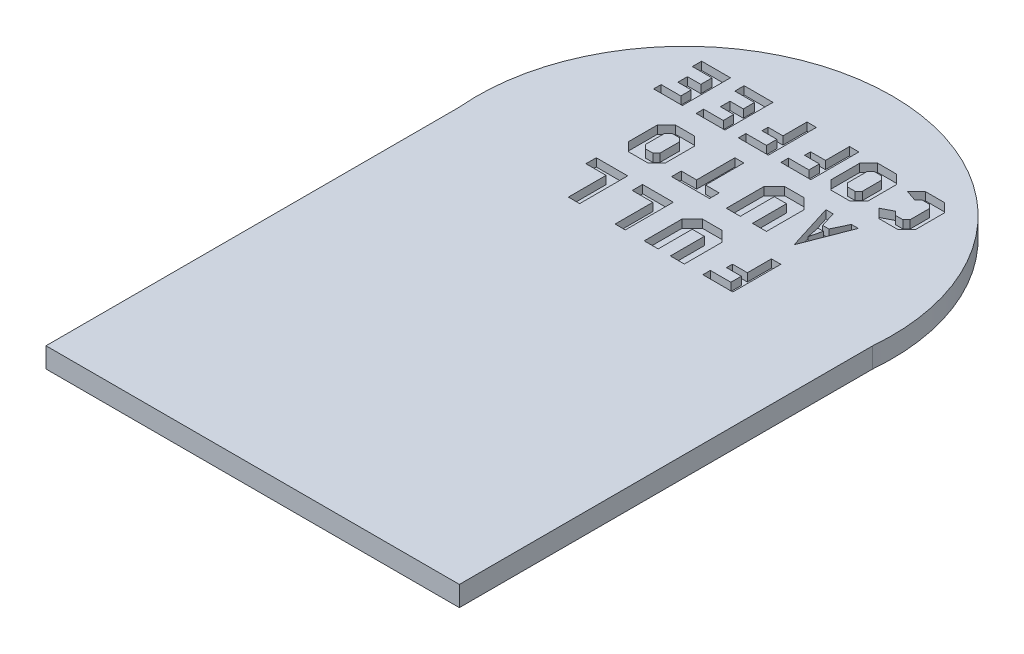
from build123d import *

# Parameters (mm, degrees)
BOSS_EXTRUDE1_DEPTH = 9.525
CUT_EXTRUDE2_DEPTH  = 3.81


with BuildPart() as part:
    # Sketch1 → Boss-Extrude1 (new body)
    with BuildSketch(Plane(origin=(0, 0, 0), x_dir=(1, 0, 0), z_dir=(0, 1, 0))):
        with BuildLine():
            Line((97.71749718, -151.170512799), (97.71749718, 44.264481562))
            ThreePointArc((97.71749718, 44.264481562), (0, 151.170512799), (-97.71749718, 44.264481562))
            Line((-97.71749718, 44.264481562), (-97.71749718, -151.170512799))
            Line((-97.71749718, -151.170512799), (97.71749718, -151.170512799))
        make_face()
    extrude(amount=BOSS_EXTRUDE1_DEPTH)

    # Sketch6 → Cut-Extrude2 (cut)
    # profile 1 of 14: a face of its own
    with BuildSketch(Plane(origin=(0, 9.525, 0), x_dir=(1, 0, 0), z_dir=(0, 1, 0))):
        Polygon((33.092657348, 98.123996841), (37.338207897, 102.36954739), (37.338207897, 115.93619224), (33.092657348, 120.181742789), (24.134649579, 120.181742789), (19.88909903, 115.93619224), (19.88909903, 102.36954739), (24.134649579, 98.123996841), align=None)
        Polygon((32.009058395, 105.057212183), (32.009058395, 114.223251329), (30.296117484, 115.93619224), (26.763976293, 115.93619224), (25.051035382, 114.223251329), (25.051035382, 105.057212183), (26.763976293, 103.344271272), (30.296117484, 103.344271272), align=None, mode=Mode.SUBTRACT)
    # profile 2 of 14: a face of its own
    with BuildSketch(Plane(origin=(0, 9.525, 0), x_dir=(1, 0, 0), z_dir=(0, 1, 0))):
        Polygon((15.096379444, 120.341514173), (15.096379444, 97.632030055), (0.938697555, 97.632030055), (0.938697555, 101.16971786), (10.645362719, 101.16971786), (10.645362719, 106.118213826), (3.603272306, 106.118213826), (3.603272306, 108.986772114), (10.645362719, 108.986772114), (10.645362719, 120.341514173), align=None)
    # profile 3 of 14: a face of its own
    with BuildSketch(Plane(origin=(0, 9.525, 0), x_dir=(1, 0, 0), z_dir=(0, 1, 0))):
        Polygon((-5.001442416, 120.341514173), (-5.001442416, 97.632030055), (-19.159124305, 97.632030055), (-19.159124305, 101.16971786), (-9.452459141, 101.16971786), (-9.452459141, 106.118213826), (-16.494549554, 106.118213826), (-16.494549554, 108.986772114), (-9.452459141, 108.986772114), (-9.452459141, 120.341514173), align=None)
    # profile 4 of 14: a face of its own
    with BuildSketch(Plane(origin=(0, 9.525, 0), x_dir=(1, 0, 0), z_dir=(0, 1, 0))):
        Polygon((-25.530137945, 97.632030055), (-25.530137945, 120.341514173), (-39.154208677, 120.341514173), (-39.154208677, 115.93619224), (-29.852737402, 115.93619224), (-29.852737402, 110.647749127), (-36.164450053, 110.647749127), (-36.164450053, 106.118213826), (-29.852737402, 106.118213826), (-29.852737402, 101.16971786), (-39.154208677, 101.16971786), (-39.154208677, 97.632030055), align=None)
    # profile 5 of 14: a face of its own
    with BuildSketch(Plane(origin=(0, 9.525, 0), x_dir=(1, 0, 0), z_dir=(0, 1, 0))):
        Polygon((-45.629989416, 97.632030055), (-45.629989416, 120.341514173), (-59.254060148, 120.341514173), (-59.254060148, 115.93619224), (-49.952588874, 115.93619224), (-49.952588874, 110.647749127), (-56.264301525, 110.647749127), (-56.264301525, 106.118213826), (-49.952588874, 106.118213826), (-49.952588874, 101.16971786), (-59.254060148, 101.16971786), (-59.254060148, 97.632030055), align=None)
    # profile 6 of 14: a face of its own
    with BuildSketch(Plane(origin=(0, 9.525, 0), x_dir=(1, 0, 0), z_dir=(0, 1, 0))):
        Polygon((56.014140131, 97.791801439), (60.25969068, 102.037351987), (60.25969068, 115.603996838), (56.014140131, 119.849547386), (47.056132361, 119.849547386), (42.810581813, 115.603996838), (47.972518164, 113.891055926), (49.685459076, 115.603996838), (53.217600267, 115.603996838), (54.930541178, 113.891055926), (54.930541178, 104.72501678), (53.217600267, 103.012075869), (49.685459076, 103.012075869), (47.972518164, 104.72501678), (42.810581813, 102.037351987), (47.056132361, 97.791801439), align=None)
    # profile 7 of 14: a face of its own
    with BuildSketch(Plane(origin=(0, 9.525, 0), x_dir=(1, 0, 0), z_dir=(0, 1, 0))):
        Polygon((46.256694641, 88.906465887), (37.770145128, 67.025884381), (30.923160439, 88.906465887), (34.346652783, 88.906465887), (36.59540746, 81.720228117), (39.556315047, 81.720228117), (42.979807391, 88.906465887), align=None)
        Polygon((39.173576909, 79.476641187), (37.770145128, 73.596131698), (36.59540746, 79.476641187), align=None, mode=Mode.SUBTRACT)
    # profile 8 of 14: a face of its own
    with BuildSketch(Plane(origin=(0, 9.525, 0), x_dir=(1, 0, 0), z_dir=(0, 1, 0))):
        Polygon((25.780141215, 65.949951837), (25.780141215, 83.762147236), (20.882852495, 88.659435955), (11.695960389, 88.659435955), (6.798671669, 83.762147236), (6.798671669, 65.949951837), (13.4089013, 65.949951837), (13.4089013, 82.049206325), (19.169911584, 82.049206325), (19.169911584, 65.949951837), align=None)
    # profile 9 of 14: a face of its own
    with BuildSketch(Plane(origin=(0, 9.525, 0), x_dir=(1, 0, 0), z_dir=(0, 1, 0))):
        Polygon((-1.155135004, 65.949951837), (-19.098887817, 65.949951837), (-19.098887817, 70.546898561), (-11.841881115, 70.546898561), (-11.841881115, 88.659435955), (-7.598614277, 88.659435955), (-7.598614277, 70.546898561), (-1.155135004, 70.546898561), align=None)
    # profile 10 of 14: a face of its own
    with BuildSketch(Plane(origin=(0, 9.525, 0), x_dir=(1, 0, 0), z_dir=(0, 1, 0))):
        Polygon((-30.386528779, 65.949951837), (-26.140978231, 70.195502386), (-26.140978231, 83.762147236), (-30.386528779, 88.007697785), (-39.344536549, 88.007697785), (-43.590087097, 83.762147236), (-43.590087097, 70.195502386), (-39.344536549, 65.949951837), align=None)
        Polygon((-31.470127732, 72.883167179), (-31.470127732, 82.049206325), (-33.183068644, 83.762147236), (-36.715209834, 83.762147236), (-38.428150746, 82.049206325), (-38.428150746, 72.883167179), (-36.715209834, 71.170226268), (-33.183068644, 71.170226268), align=None, mode=Mode.SUBTRACT)
    # profile 11 of 14: a face of its own
    with BuildSketch(Plane(origin=(0, 9.525, 0), x_dir=(1, 0, 0), z_dir=(0, 1, 0))):
        Polygon((42.629516338, 55.895606059), (42.629516338, 33.186121941), (28.47183445, 33.186121941), (28.47183445, 36.723809746), (38.178499614, 36.723809746), (38.178499614, 41.672305712), (31.136409201, 41.672305712), (31.136409201, 44.540864), (38.178499614, 44.540864), (38.178499614, 55.895606059), align=None)
    # profile 12 of 14: a face of its own
    with BuildSketch(Plane(origin=(0, 9.525, 0), x_dir=(1, 0, 0), z_dir=(0, 1, 0))):
        Polygon((19.716803126, 33.186121941), (19.716803126, 50.99831734), (14.819514406, 55.895606059), (5.6326223, 55.895606059), (0.73533358, 50.99831734), (0.73533358, 33.186121941), (7.345563211, 33.186121941), (7.345563211, 49.285376429), (13.106573495, 49.285376429), (13.106573495, 33.186121941), align=None)
    # profile 13 of 14: a face of its own
    with BuildSketch(Plane(origin=(0, 9.525, 0), x_dir=(1, 0, 0), z_dir=(0, 1, 0))):
        Polygon((-8.199393392, 33.186121941), (-8.199393392, 55.895606059), (-22.72606612, 55.895606059), (-22.72606612, 50.99831734), (-13.019400957, 50.99831734), (-13.019400957, 33.186121941), align=None)
    # profile 14 of 14: a face of its own
    with BuildSketch(Plane(origin=(0, 9.525, 0), x_dir=(1, 0, 0), z_dir=(0, 1, 0))):
        Polygon((-29.768156533, 33.186121941), (-29.768156533, 55.895606059), (-44.613644431, 55.895606059), (-44.613644431, 50.99831734), (-35.097306035, 50.99831734), (-35.097306035, 33.186121941), align=None)
    extrude(amount=-CUT_EXTRUDE2_DEPTH, mode=Mode.SUBTRACT)


solid = part.part
